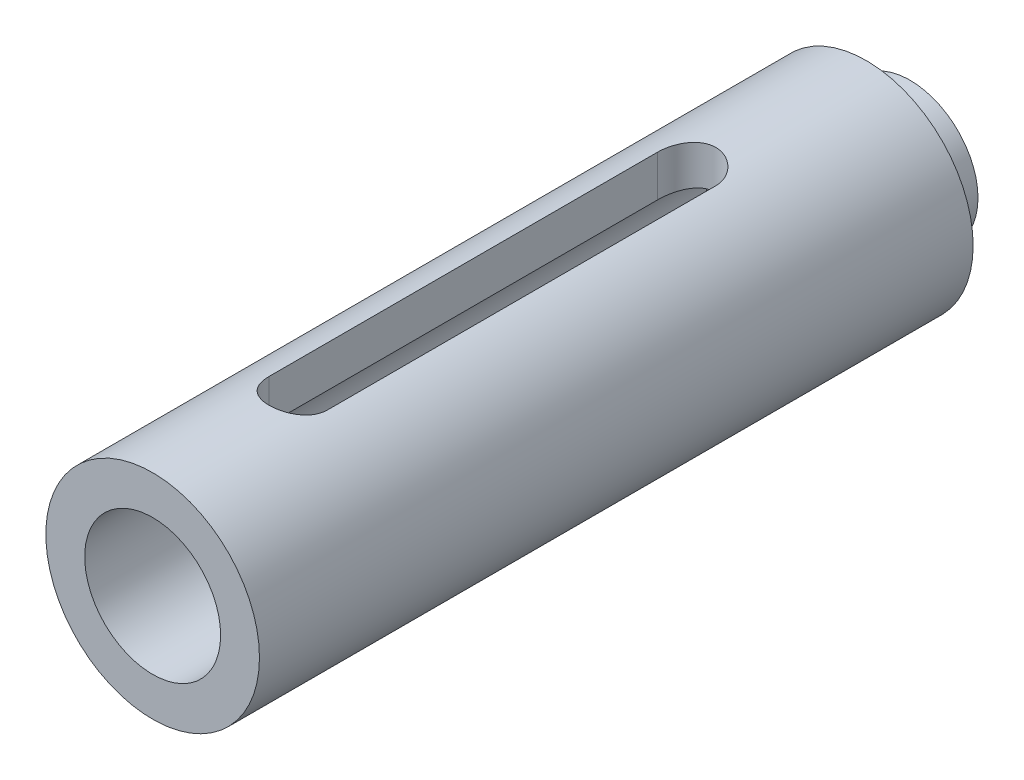
from build123d import *

# Parameters (mm, degrees)
SKETCH1_R           = 3.5
BOSS_EXTRUDE1_DEPTH = 2.25
SKETCH2_R           = 5.5
BOSS_EXTRUDE2_DEPTH = 36.75
CUT_EXTRUDE1_START  = -33
SKETCH3_R           = 3.5
CUT_EXTRUDE1_DEPTH  = 33
CUT_EXTRUDE2_REACH  = 41.768
SKETCH4_R           = 2
CHAMFER1_SIZE2      = 1.5
CHAMFER1_SIZE       = 1
CUT_EXTRUDE3_DEPTH  = 40.76807765


with BuildPart() as part:
    # Sketch1 → Boss-Extrude1 (new body)
    with BuildSketch(Plane.XY):
        Circle(SKETCH1_R)
    extrude(amount=BOSS_EXTRUDE1_DEPTH)

    # Sketch2 → Boss-Extrude2 (add)
    with BuildSketch(Plane.XY.offset(2.25)):
        Circle(SKETCH2_R)
    extrude(amount=BOSS_EXTRUDE2_DEPTH)

    # Sketch3 → Cut-Extrude1 (cut)
    with BuildSketch(Plane.XY.offset(39).offset(CUT_EXTRUDE1_START)):
        Circle(SKETCH3_R)
    extrude(amount=CUT_EXTRUDE1_DEPTH, mode=Mode.SUBTRACT)

    # Sketch4 → Cut-Extrude2 (cut, up to next)
    with BuildSketch(Plane(origin=(0, 0, 0), x_dir=(-1, 0, 0), z_dir=(0, 0, -1)), mode=Mode.PRIVATE) as cut_extrude2_sk1:
        Circle(SKETCH4_R)
    cut_extrude2_tool1 = extrude(cut_extrude2_sk1.sketch, amount=-CUT_EXTRUDE2_REACH, mode=Mode.PRIVATE) & part.part
    add(cut_extrude2_tool1.solids().sort_by_distance((0, 0, 0))[0], mode=Mode.SUBTRACT)

    # Chamfer1
    chamfer1_edges = [part.edges().sort_by_distance(p)[0] for p in [
        (-3.5, 0, 6),
    ]]
    chamfer1_side = [part.faces().sort_by_distance(p)[0] for p in [
        (-3.5, 0, 6.02),
    ]]
    chamfer(chamfer1_edges, length=CHAMFER1_SIZE - 0.0001, length2=CHAMFER1_SIZE2 - 0.0001, reference=chamfer1_side[0])  # a hair under: the kernel refuses the full size

    # Sketch5 → Cut-Extrude3 (cut, through all)
    with BuildSketch(Plane(origin=(0, 0, 0), x_dir=(1, 0, 0), z_dir=(0, 1, 0))):
        with BuildLine():
            Line((-1.5, -11.5), (-1.5, -31.5))
            ThreePointArc((-1.5, -31.5), (0, -33), (1.5, -31.5))
            Line((1.5, -31.5), (1.5, -11.5))
            ThreePointArc((1.5, -11.5), (0, -10), (-1.5, -11.5))
        make_face()
    extrude(amount=CUT_EXTRUDE3_DEPTH, mode=Mode.SUBTRACT)


solid = part.part
